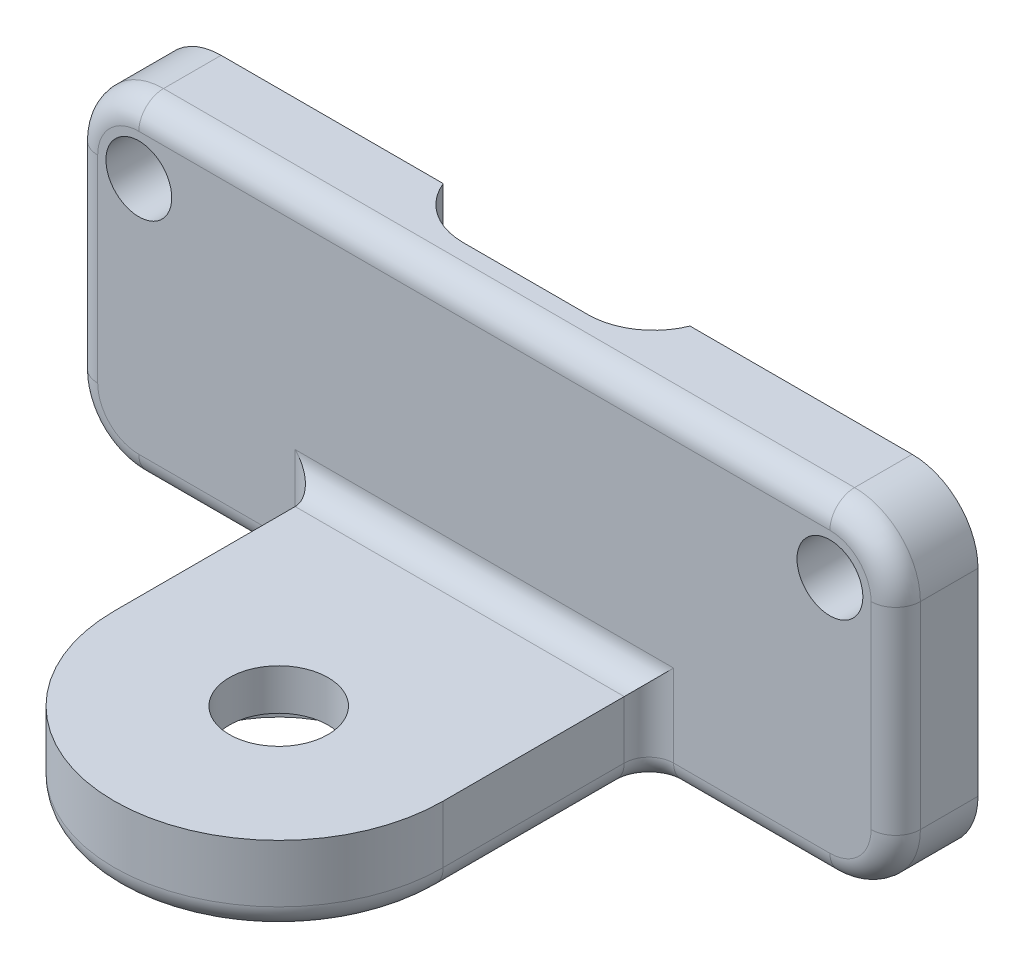
from build123d import *

# Parameters (mm, degrees)
SKETCH_1_W          = 100
SKETCH_1_H          = 40
EXTRUDE_1_DEPTH     = 10
EXTRUDE_2_DEPTH     = 10
SKETCH_4_R          = 12.5
CUT_EXTRUDE_1_DEPTH = 5
SKETCH_5_R          = 6
CUT_EXTRUDE_2_DEPTH = 5
SKETCH_6_W          = 30
SKETCH_6_H          = 5
CUT_EXTRUDE_3_DEPTH = 85.409715081
FILLET_1_R          = 8
FILLET_2_R          = 3
SKETCH_7_R          = 4
CUT_EXTRUDE_5_DEPTH = 71.178344238


with BuildPart() as part:
    # Эскиз1 → Бобышка-Вытянуть1 (new body)
    with BuildSketch(Plane.XY):
        Rectangle(SKETCH_1_W, SKETCH_1_H)
    extrude(amount=EXTRUDE_1_DEPTH)

    # Эскиз2 → Бобышка-Вытянуть2 (add)
    with BuildSketch(Plane.XZ.offset(20)):
        with BuildLine():
            Line((-20, 0), (-20, 35))
            ThreePointArc((-20, 35), (0, 55), (20, 35))
            Line((20, 35), (20, 0))
            Line((20, 0), (-20, 0))
        make_face()
    extrude(amount=-EXTRUDE_2_DEPTH)

    # Эскиз4 → Вырез-Вытянуть1 (cut)
    with BuildSketch(Plane.XZ.offset(20)):
        with Locations((0, 35)):
            Circle(SKETCH_4_R)
    extrude(amount=-CUT_EXTRUDE_1_DEPTH, mode=Mode.SUBTRACT)

    # Эскиз5 → Вырез-Вытянуть2 (cut)
    with BuildSketch(Plane.XZ.offset(15)):
        with Locations((0, 35)):
            Circle(SKETCH_5_R)
    extrude(amount=-CUT_EXTRUDE_2_DEPTH, mode=Mode.SUBTRACT)

    # Эскиз6 → Вырез-Вытянуть3 (cut, through all)
    with BuildSketch(Plane.XZ.offset(20)):
        with Locations((0, 2.5)):
            Rectangle(SKETCH_6_W, SKETCH_6_H)
    extrude(amount=-CUT_EXTRUDE_3_DEPTH, mode=Mode.SUBTRACT)

    # Скругление1
    # the kernel refuses this fillet: 8 mm, written as the material it adds along each edge
    with BuildSketch(Plane(origin=(-15, -20, 5), x_dir=(1, 0, 0), z_dir=(0, 1, 0))) as fillet_1_piece_1:
        with BuildLine():
            CenterArc((7.416198487, 8), FILLET_1_R, 202.024312837, 67.975687163)
            Line((0, 5), (0, 0))
            Line((0, 0), (7.416198487, 0))
        make_face()
    extrude(amount=40)
    with BuildSketch(Plane(origin=(15, -20, 5), x_dir=(0, 0, -1), z_dir=(0, 1, 0))) as fillet_1_piece_2:
        with BuildLine():
            CenterArc((8, 7.416198487), FILLET_1_R, 180, 67.975687163)
            Line((0, 7.416198487), (0, 0))
            Line((0, 0), (5, 0))
        make_face()
    extrude(amount=40)
    # the kernel refuses this fillet: 8 mm, written as the material it takes off along each edge
    with BuildSketch(Plane(origin=(50, -20, -20), x_dir=(-1, 0, 0), z_dir=(0, 0, 1)), Plane(origin=(50, 20, -20), x_dir=(0, -1, 0), z_dir=(0, 0, 1))) as fillet_1_2_piece_1:
        with BuildLine():
            CenterArc((FILLET_1_R, -FILLET_1_R), FILLET_1_R, 90, 90)
            Line((0, -FILLET_1_R), (0, 0))
            Line((0, 0), (FILLET_1_R, 0))
        make_face()
    extrude(amount=50, mode=Mode.SUBTRACT)
    with BuildSketch(Plane(origin=(-50, -20, -20), x_dir=(1, 0, 0), z_dir=(0, 0, 1)), Plane(origin=(-50, 20, -20), x_dir=(0, -1, 0), z_dir=(0, 0, 1))) as fillet_1_2_piece_2:
        with BuildLine():
            CenterArc((FILLET_1_R, FILLET_1_R), FILLET_1_R, 180, 90)
            Line((0, FILLET_1_R), (0, 0))
            Line((0, 0), (FILLET_1_R, 0))
        make_face()
    extrude(amount=50, mode=Mode.SUBTRACT)

    # Скругление2
    fillet_2_edges = [part.edges().sort_by_distance(p)[0] for p in [
        (31, -20, 10),
        (-20, -15, 10),
        (-20, -20, 22.5),
        (0, -20, 55),
        (20, -15, 10),
        (0, -10, 10),
        (20, -20, 22.5),
        (50, 0, 10),
        (-31, -20, 10),
        (0, 20, 10),
        (-50, 0, 10),
        (47.656854249, 17.656854249, 10),
        (-47.656854249, 17.656854249, 10),
        (-47.656854249, -17.656854249, 10),
        (47.656854249, -17.656854249, 10),
    ]]
    fillet(fillet_2_edges, radius=FILLET_2_R)

    # Эскиз7 → Вырез-Вытянуть5 (cut, through all)
    with BuildSketch(Plane.XY.offset(10)):
        with Locations((-42, 12)):
            Circle(SKETCH_7_R)
        with Locations(Location((42, 12, 0), (0, 0, 180))):
            Circle(SKETCH_7_R)
    extrude(amount=-CUT_EXTRUDE_5_DEPTH, mode=Mode.SUBTRACT)


solid = part.part
